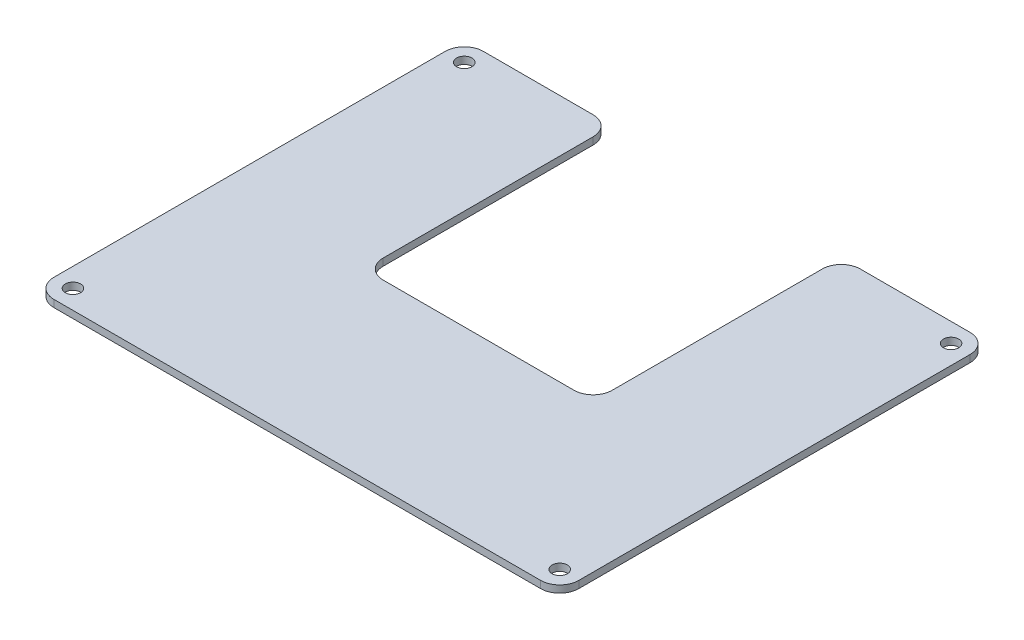
from build123d import *

# Parameters (mm, degrees)
SKETCH1_W           = 110
SKETCH1_H           = 90
BOSS_EXTRUDE1_DEPTH = 1.5
CUT_EXTRUDE1_DEPTH  = 10
FILLET1_R           = 4
SKETCH4_R           = 1.6
CUT_EXTRUDE2_DEPTH  = 10


with BuildPart() as part:
    # Sketch1 → Boss-Extrude1 (new body)
    with BuildSketch(Plane(origin=(0, 0, 0), x_dir=(1, 0, 0), z_dir=(0, 1, 0))):
        Rectangle(SKETCH1_W, SKETCH1_H)
    extrude(amount=BOSS_EXTRUDE1_DEPTH)

    # Sketch2 → Cut-Extrude1 (cut)
    with BuildSketch(Plane(origin=(0, 0, 0), x_dir=(-1, 0, 0), z_dir=(0, -1, 0))):
        Polygon((0, 45), (-24, 45), (-24, -7), (24, -7), (24, 45), align=None)
    extrude(amount=-CUT_EXTRUDE1_DEPTH, mode=Mode.SUBTRACT)

    # Fillet1
    fillet1_edges = [part.edges().sort_by_distance(p)[0] for p in [
        (55, 0.75, -45),
        (-55, 0.75, -45),
        (55, 0.75, 45),
        (-55, 0.75, 45),
        (24, 0.75, 7),
        (-24, 0.75, 7),
        (-24, 0.75, -45),
        (24, 0.75, -45),
    ]]
    fillet(fillet1_edges, radius=FILLET1_R)

    # Sketch4 → Cut-Extrude2 (cut)
    with BuildSketch(Plane(origin=(0, 0, 0), x_dir=(-1, 0, 0), z_dir=(0, -1, 0))):
        with Locations((51, -41)):
            Circle(SKETCH4_R)
        with Locations((51, 41)):
            Circle(SKETCH4_R)
        with Locations((-51, 41)):
            Circle(SKETCH4_R)
        with Locations((-51, -41)):
            Circle(SKETCH4_R)
    extrude(amount=-CUT_EXTRUDE2_DEPTH, mode=Mode.SUBTRACT)


solid = part.part
